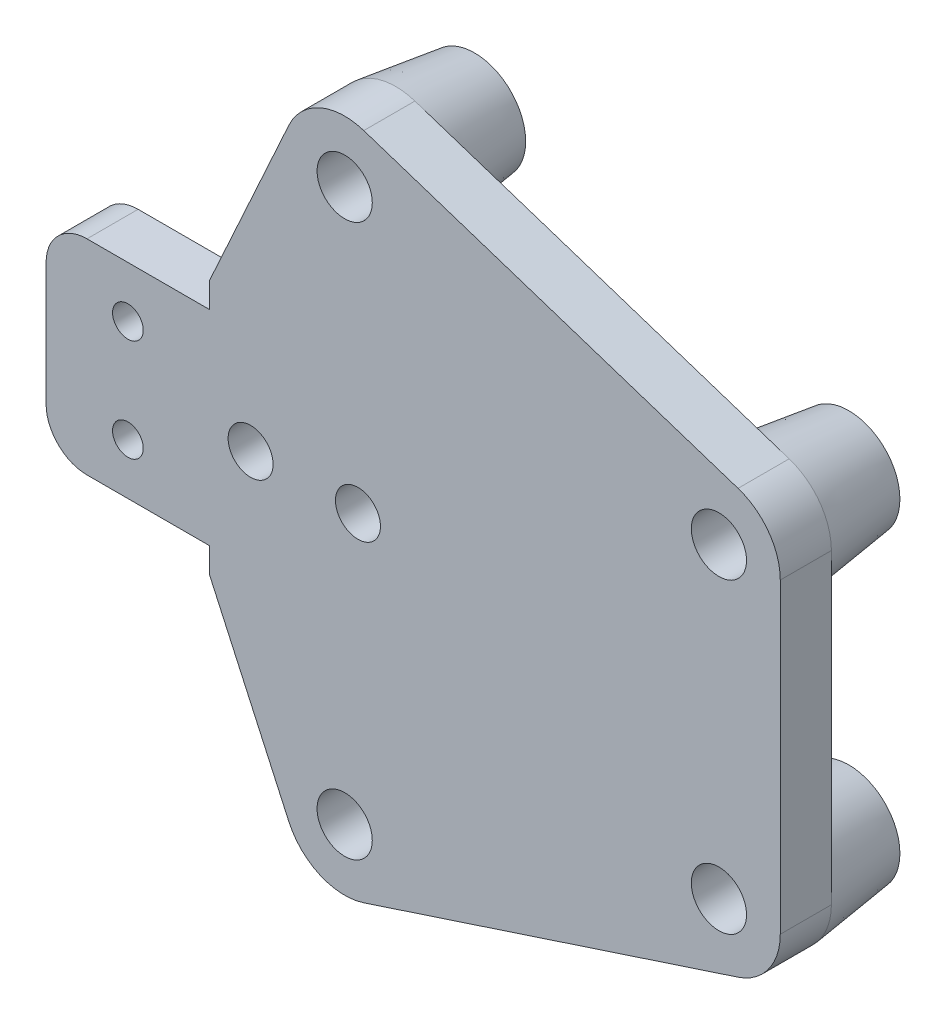
from build123d import *

# Parameters (mm, degrees)
SKETCH_1_R          = 2.2
SKETCH_1_R_2        = 2.7
SKETCH_1_R_3        = 1.5
EXTRUDE_1_DEPTH     = 5
SKETCH_1_4_W        = 19.5
SKETCH_1_4_H        = 2
EXTRUDE_2_DEPTH     = 6.8
CHAMFER_1_SIZE2     = 6.8
CHAMFER_1_SIZE      = 3
CHAMFER_2_SIZE2     = 6.8
CHAMFER_2_SIZE      = 3
CUT_EXTRUDE_1_DEPTH = 2.5


with BuildPart() as part:
    # 草图1 → 凸台-拉伸1 (new body)
    with BuildSketch(Plane.XY):
        with BuildLine():
            Line((-23.759975961, 29.487702254), (-31.5, 12.5))
            Line((-31.5, 12.5), (-31.5, 10))
            Line((-31.5, 10), (-43.5, 10))
            ThreePointArc((-43.5, 10), (-46.328427125, 8.828427125), (-47.5, 6))
            Line((-47.5, 6), (-47.5, -6))
            ThreePointArc((-47.5, -6), (-46.328427125, -8.828427125), (-43.5, -10))
            Line((-43.5, -10), (-31.5, -10))
            Line((-31.5, -10), (-31.5, -12.5))
            Line((-31.5, -12.5), (-23.759975961, -29.487702254))
            ThreePointArc((-23.759975961, -29.487702254), (-20.709389548, -32.494983349), (-16.430695985, -32.701377246))
            Line((-16.430695985, -32.701377246), (20.169304015, -20.701377246))
            ThreePointArc((20.169304015, -20.701377246), (23.158797387, -18.520239758), (24.3, -15))
            Line((24.3, -15), (24.3, 15))
            ThreePointArc((24.3, 15), (23.158797387, 18.520239758), (20.169304015, 20.701377246))
            Line((20.169304015, 20.701377246), (-16.430695985, 32.701377246))
            ThreePointArc((-16.430695985, 32.701377246), (-20.709389548, 32.494983349), (-23.759975961, 29.487702254))
        make_face()
        with Locations((-17, 0)):
            Circle(SKETCH_1_R, mode=Mode.SUBTRACT)
        with Locations((-27.5, 0)):
            Circle(SKETCH_1_R, mode=Mode.SUBTRACT)
        with Locations((18.3, 15)):
            Circle(SKETCH_1_R_2, mode=Mode.SUBTRACT)
        with Locations((-39.5, 5)):
            Circle(SKETCH_1_R_3, mode=Mode.SUBTRACT)
        with Locations((-39.5, -5)):
            Circle(SKETCH_1_R_3, mode=Mode.SUBTRACT)
        with Locations((18.3, -15)):
            Circle(SKETCH_1_R_2, mode=Mode.SUBTRACT)
        with Locations((-18.3, 27)):
            Circle(SKETCH_1_R_2, mode=Mode.SUBTRACT)
        with Locations((-18.3, -27)):
            Circle(SKETCH_1_R_2, mode=Mode.SUBTRACT)
    extrude(amount=EXTRUDE_1_DEPTH)

    # 草图4 → 旋转1 (revolve)
    with BuildSketch(Plane(origin=(6.216937636, 18.961659791, 0), x_dir=(-0.9502295409734977, 0.31155066917163887, 0), z_dir=(-0.31155066917163887, -0.9502295409734977, 0)), mode=Mode.PRIVATE) as revolve_1_sk:
        Polygon((-6.715940562, 0), (-7.715940562, 7.7), (-10.015940562, 7.7), (-10.015940562, 0), align=None)
    revolve_1 = revolve(revolve_1_sk.sketch.rotate(Axis((18.3, 15, 4.45283877), (0, 0, -1)), 161.847294113), axis=Axis((18.3, 15, 4.45283877), (0, 0, -1)))

    # 草图4<3> → 旋转2 (revolve)
    with BuildSketch(Plane(origin=(6.216937636, 18.961659791, 0), x_dir=(-0.9502295409734977, 0.31155066917163887, 0), z_dir=(-0.31155066917163887, -0.9502295409734977, 0)), mode=Mode.PRIVATE) as revolve_2_sk:
        Polygon((30.801068667, 7.7), (28.501068667, 7.7), (28.501068667, 0), (31.801068667, 0), align=None)
    revolve_2 = revolve(revolve_2_sk.sketch.rotate(Axis((-18.3, 27, 0), (0, 0, -1)), 161.847294113), axis=Axis((-18.3, 27, 0), (0, 0, -1)))

    # 镜向1: 旋转1, 旋转2 across plane
    add(revolve_1.mirror(Plane.ZX))
    add(revolve_2.mirror(Plane.ZX))

    # 草图1<4> → 凸台-拉伸2 (add)
    with BuildSketch(Plane.XY):
        with Locations((-21.75, 11.3)):
            Rectangle(SKETCH_1_4_W, SKETCH_1_4_H)
        with Locations((-21.75, -11.3)):
            Rectangle(SKETCH_1_4_W, SKETCH_1_4_H)
    extrude(amount=-EXTRUDE_2_DEPTH)

    # 倒角1
    chamfer_1_edges = [part.edges().sort_by_distance(p)[0] for p in [
        (-21.75, 12.3, 0),
    ]]
    chamfer_1_side = [part.faces().sort_by_distance(p)[0] for p in [
        (-21.75, 12.36, 0),
    ]]
    chamfer(chamfer_1_edges, length=CHAMFER_1_SIZE - 0.0001, length2=CHAMFER_1_SIZE2 - 0.0001, reference=chamfer_1_side[0])  # a hair under: the kernel refuses the full size

    # 倒角2
    chamfer_2_edges = [part.edges().sort_by_distance(p)[0] for p in [
        (-21.75, -12.3, 0),
    ]]
    chamfer_2_side = [part.faces().sort_by_distance(p)[0] for p in [
        (-21.75, -12.36, 0),
    ]]
    chamfer(chamfer_2_edges, length=CHAMFER_2_SIZE - 0.0001, length2=CHAMFER_2_SIZE2 - 0.0001, reference=chamfer_2_side[0])  # a hair under: the kernel refuses the full size

    # 草图5 → 切除-拉伸1 (cut)
    with BuildSketch(Plane(origin=(0, 0, 0), x_dir=(-1, 0, 0), z_dir=(0, 0, -1))):
        with BuildLine():
            Line((41, 5), (41, -5))
            ThreePointArc((41, -5), (39.5, -6.5), (38, -5))
            Line((38, -5), (38, 5))
            ThreePointArc((38, 5), (39.5, 6.5), (41, 5))
        make_face()
    extrude(amount=-CUT_EXTRUDE_1_DEPTH, mode=Mode.SUBTRACT)


solid = part.part
